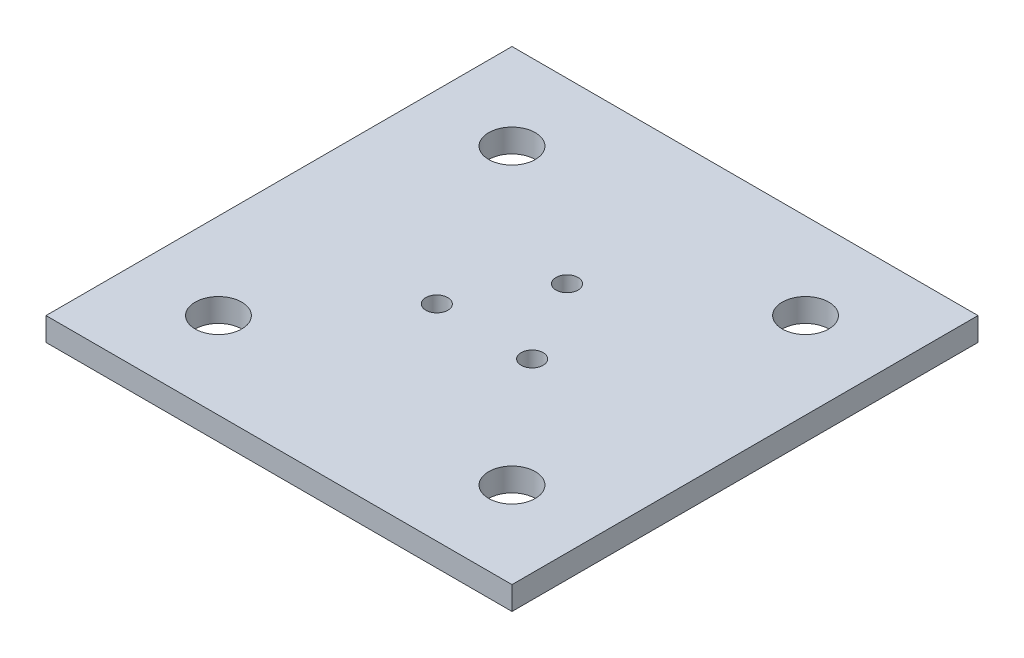
from build123d import *

# Parameters (mm, degrees)
SKETCH1_W           = 63.5
SKETCH1_H           = 63.5
BOSS_EXTRUDE1_DEPTH = 3.175
SKETCH2_R           = 1.5
CUT_EXTRUDE1_DEPTH  = 46.01339384
SKETCH3_R           = 3.175
CUT_EXTRUDE2_DEPTH  = 46.01339384


with BuildPart() as part:
    # Sketch1 → Boss-Extrude1 (new body)
    with BuildSketch(Plane(origin=(0, 0, 0), x_dir=(1, 0, 0), z_dir=(0, 1, 0))):
        Rectangle(SKETCH1_W, SKETCH1_H)
    extrude(amount=BOSS_EXTRUDE1_DEPTH)

    # Sketch2 → Cut-Extrude1 (cut, through all)
    with BuildSketch(Plane(origin=(0, 3.175, 0), x_dir=(1, 0, 0), z_dir=(0, 1, 0))):
        with Locations((0, 7.5)):
            Circle(SKETCH2_R)
        with Locations((6.495190528, -3.75)):
            Circle(SKETCH2_R)
        with Locations((-6.495190528, -3.75)):
            Circle(SKETCH2_R)
    extrude(amount=-CUT_EXTRUDE1_DEPTH, mode=Mode.SUBTRACT)

    # Sketch3 → Cut-Extrude2 (cut, through all)
    with BuildSketch(Plane(origin=(0, 3.175, 0), x_dir=(1, 0, 0), z_dir=(0, 1, 0))):
        with Locations((-20, 20)):
            Circle(SKETCH3_R)
        with Locations((20, 20)):
            Circle(SKETCH3_R)
        with Locations((20, -20)):
            Circle(SKETCH3_R)
        with Locations((-20, -20)):
            Circle(SKETCH3_R)
    extrude(amount=-CUT_EXTRUDE2_DEPTH, mode=Mode.SUBTRACT)


solid = part.part
